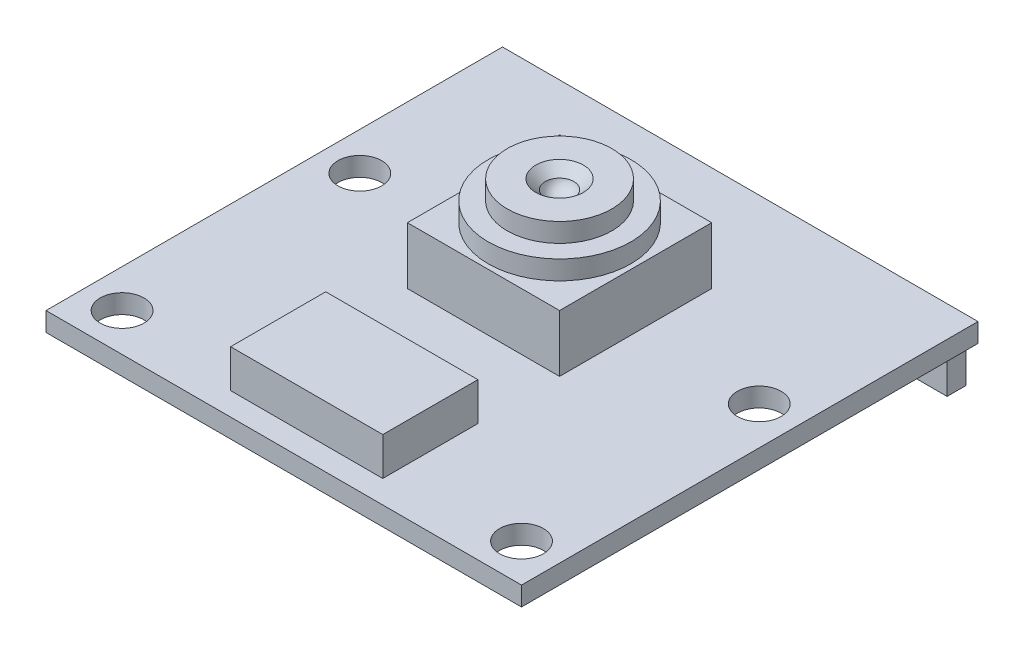
from build123d import *

# Parameters (mm, degrees)
SKETCH1_W           = 25
SKETCH1_H           = 24
BOSS_EXTRUDE1_DEPTH = 1
SKETCH2_R           = 1.15
CUT_EXTRUDE1_DEPTH  = 1
SKETCH3_W           = 8
SKETCH3_H           = 5
BOSS_EXTRUDE2_DEPTH = 2
SKETCH4_W           = 8
SKETCH4_H           = 8
BOSS_EXTRUDE3_DEPTH = 3
SKETCH5_R           = 3.75
BOSS_EXTRUDE4_DEPTH = 1
SKETCH6_R           = 2.75
BOSS_EXTRUDE5_DEPTH = 1
SKETCH7_R           = 0.75
CUT_EXTRUDE3_DEPTH  = 1
CHAMFER1_SIZE       = 0.5
FILLET2_R           = 0.7
BOSS_EXTRUDE6_DEPTH = 2
SKETCH9_W           = 24
SKETCH9_H           = 1
BOSS_EXTRUDE7_DEPTH = 0.1


with BuildPart() as part:
    # Sketch1 → Boss-Extrude1 (new body)
    with BuildSketch(Plane(origin=(0, 0, 0), x_dir=(1, 0, 0), z_dir=(0, 1, 0))):
        Rectangle(SKETCH1_W, SKETCH1_H)
    extrude(amount=BOSS_EXTRUDE1_DEPTH)

    # Sketch2 → Cut-Extrude1 (cut)
    with BuildSketch(Plane(origin=(0, 1, 0), x_dir=(1, 0, 0), z_dir=(0, 1, 0))):
        with Locations(Location((10.5, -10, 0), (0, 0, 270))):
            Circle(SKETCH2_R)
        with Locations(Location((-10.5, -10, 0), (0, 0, 270))):
            Circle(SKETCH2_R)
        with Locations(Location((-10.5, 2.5, 0), (0, 0, 270))):
            Circle(SKETCH2_R)
        with Locations(Location((10.5, 2.5, 0), (0, 0, 270))):
            Circle(SKETCH2_R)
    extrude(amount=-CUT_EXTRUDE1_DEPTH, mode=Mode.SUBTRACT)

    # Sketch3 → Boss-Extrude2 (add)
    with BuildSketch(Plane(origin=(0, 1, 0), x_dir=(1, 0, 0), z_dir=(0, 1, 0))):
        with Locations((0, -8.293334271)):
            Rectangle(SKETCH3_W, SKETCH3_H)
    extrude(amount=BOSS_EXTRUDE2_DEPTH)

    # Sketch4 → Boss-Extrude3 (add)
    with BuildSketch(Plane(origin=(0, 1, 0), x_dir=(1, 0, 0), z_dir=(0, 1, 0))):
        with Locations((0, 2.5)):
            Rectangle(SKETCH4_W, SKETCH4_H)
    extrude(amount=BOSS_EXTRUDE3_DEPTH)

    # Sketch5 → Boss-Extrude4 (add)
    with BuildSketch(Plane(origin=(0, 4, 0), x_dir=(1, 0, 0), z_dir=(0, 1, 0))):
        with Locations(Location((0, 2.5, 0), (0, 0, 270))):
            Circle(SKETCH5_R)
    extrude(amount=BOSS_EXTRUDE4_DEPTH)

    # Sketch6 → Boss-Extrude5 (add)
    with BuildSketch(Plane(origin=(0, 5, 0), x_dir=(1, 0, 0), z_dir=(0, 1, 0))):
        with Locations(Location((0, 2.5, 0), (0, 0, 270))):
            Circle(SKETCH6_R)
    extrude(amount=BOSS_EXTRUDE5_DEPTH)

    # Sketch7 → Cut-Extrude3 (cut)
    with BuildSketch(Plane(origin=(0, 6, 0), x_dir=(1, 0, 0), z_dir=(0, 1, 0))):
        with Locations(Location((0, 2.5, 0), (0, 0, 270))):
            Circle(SKETCH7_R)
    extrude(amount=-CUT_EXTRUDE3_DEPTH, mode=Mode.SUBTRACT)

    # Chamfer1
    chamfer1_edges = [part.edges().sort_by_distance(p)[0] for p in [
        (0, 6, -3.25),
    ]]
    chamfer(chamfer1_edges, length=CHAMFER1_SIZE)

    # Fillet2
    # the kernel refuses this fillet: 0.7 mm, written as the material it adds along each edge
    with BuildSketch(Plane(origin=(0, 5, -2.5), x_dir=(0, 0, 1), z_dir=(-1, 0, 0))) as fillet2_piece_1:
        with BuildLine():
            CenterArc((0.079179607, 0.7), FILLET2_R, 270, 73.398450401)
            Line((0.079179607, 0), (0.079179607, -0.014))
            Line((0.079179607, -0.014), (0.75, -0.014))
            Line((0.75, -0.014), (0.764, 0))
            ThreePointArc((0.764, 0), (0.764, 0.25), (0.763416408, 0.496))
            Line((0.763416408, 0.496), (0.75, 0.5))
        make_face()
    revolve(axis=Axis((0, 5, -2.5), (0, 1, 0)))

    # Sketch8 → Boss-Extrude6 (add)
    with BuildSketch(Plane.XZ):
        Polygon((10.5, -11.875), (12, -11.875), (12, -10.875), (10.5, -10.875), (10.5, -6.625), (-10.5, -6.625), (-10.5, -10.875), (-12, -10.875), (-12, -11.875), (-10.5, -11.875), align=None)
    extrude(amount=BOSS_EXTRUDE6_DEPTH)

    # Sketch9 → Boss-Extrude7 (add)
    with BuildSketch(Plane.XZ.offset(2)):
        with Locations((0, -11.375)):
            Rectangle(SKETCH9_W, SKETCH9_H)
    extrude(amount=BOSS_EXTRUDE7_DEPTH)


solid = part.part
